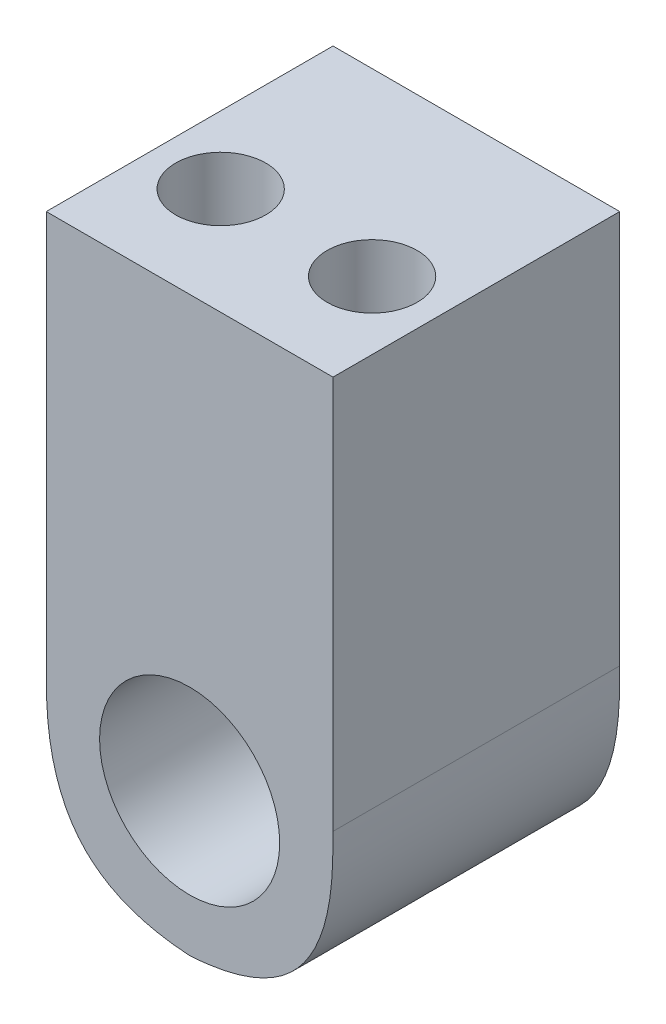
from build123d import *

# Parameters (mm, degrees)
SKETCH1_W           = 12.7
SKETCH1_H           = 12.7
SKETCH1_R           = 3.9878
BOSS_EXTRUDE1_DEPTH = 12.7
FILLET1_SIZE        = 7.9756
SKETCH3_R           = 1.9939
CUT_EXTRUDE2_DEPTH  = 6.35
SKETCH1_3_R         = 3.9878
CUT_EXTRUDE3_DEPTH  = 24.759524566


with BuildPart() as part:
    # Sketch1 → Boss-Extrude1 (new body)
    # profile 1 of 3: a face of its own
    with BuildSketch(Plane.XY):
        with Locations((0, 12.7)):
            Rectangle(SKETCH1_W, SKETCH1_H)
    # profile 2 of 3: a face of its own
    with BuildSketch(Plane.XY):
        Rectangle(SKETCH1_W, SKETCH1_H)
        Circle(SKETCH1_R, mode=Mode.SUBTRACT)
    # profile 3 of 3: a face of its own
    with BuildSketch(Plane.XY):
        Circle(SKETCH1_R)
    extrude(amount=-BOSS_EXTRUDE1_DEPTH)

    # Fillet1
    # a fillet whose section is not a circle: 7.9756 mm, written as the material it takes off along each edge
    with BuildSketch(Plane(origin=(-6.35, -6.35, 19.939), x_dir=(1, 0, 0), z_dir=(0, 0, -1)), Plane(origin=(6.35, -6.35, 19.939), x_dir=(0, 1, 0), z_dir=(0, 0, -1))) as fillet1_piece_1:
        with BuildLine():
            add(Edge.make_bspline([(FILLET1_SIZE, 0), (FILLET1_SIZE * 0.831801948466, 0), (FILLET1_SIZE * 0.663603896932, 0), (FILLET1_SIZE * 0.292893218813, -FILLET1_SIZE * 0.0716919198361), (FILLET1_SIZE * 0.0716919198361, -FILLET1_SIZE * 0.292893218813), (0, -FILLET1_SIZE * 0.663603896932), (0, -FILLET1_SIZE * 0.831801948466), (0, -FILLET1_SIZE)], knots=[0, 0, 0, 0, 0, 0, 0.5, 0.5, 1, 1, 1, 1, 1, 1], degree=5))
            Line((0, -FILLET1_SIZE), (0, 0))
            Line((0, 0), (FILLET1_SIZE, 0))
        make_face()
    extrude(amount=52.578, mode=Mode.SUBTRACT)

    # Sketch3 → Cut-Extrude2 (cut)
    with BuildSketch(Plane(origin=(0, 19.05, 0), x_dir=(1, 0, 0), z_dir=(0, 1, 0))):
        with Locations(Location((3.3528, 4.72948, 0), (0, 0, 270))):
            Circle(SKETCH3_R)
        with Locations(Location((-3.3528, 4.72948, 0), (0, 0, 270))):
            Circle(SKETCH3_R)
    extrude(amount=-CUT_EXTRUDE2_DEPTH, mode=Mode.SUBTRACT)

    # Sketch1<3> → Cut-Extrude3 (cut, through all)
    with BuildSketch(Plane.XY):
        Circle(SKETCH1_3_R)
    extrude(amount=-CUT_EXTRUDE3_DEPTH, mode=Mode.SUBTRACT)


solid = part.part
